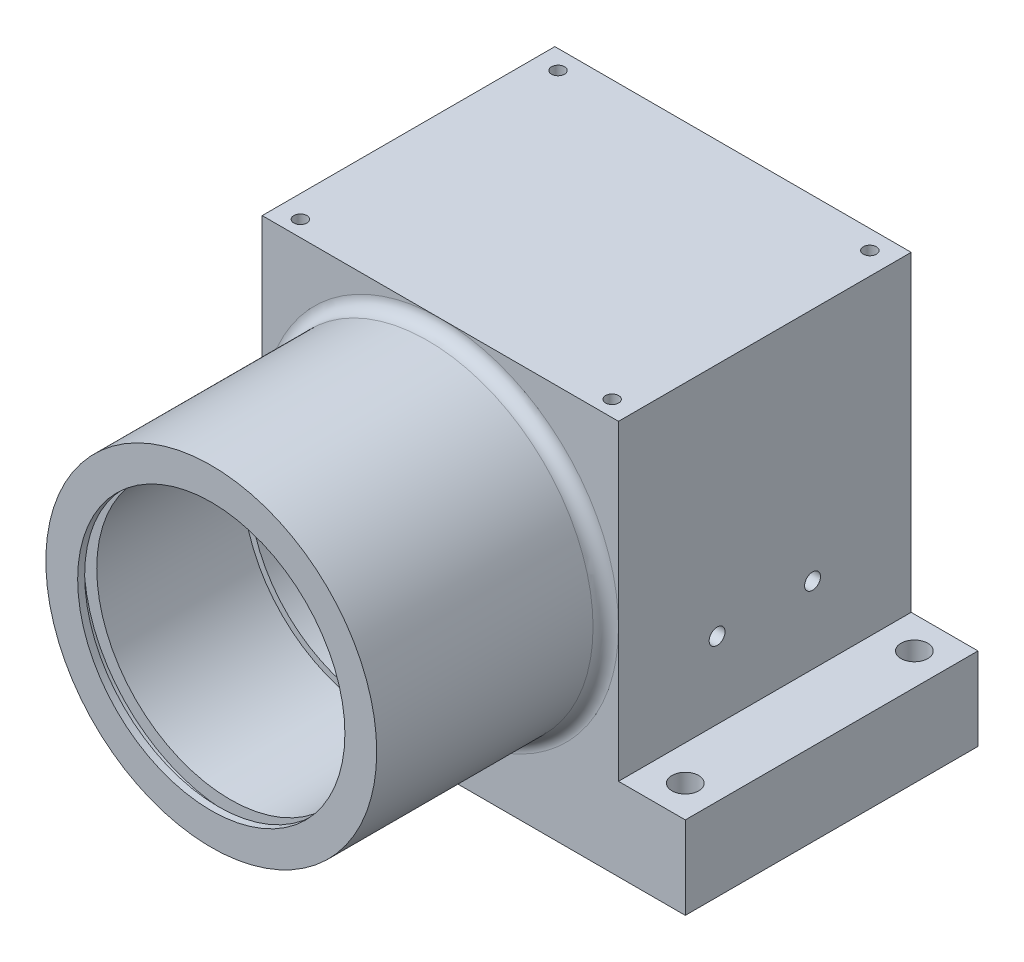
from build123d import *

# Parameters (mm, degrees)
SKETCH_1_W                  = 56
SKETCH_1_H                  = 62
EXTRUDE_1_DEPTH             = 82
SKETCH_4_W                  = 56
SKETCH_4_H                  = 62
SKETCH_4_R                  = 26
CUT_EXTRUDE_1_DEPTH         = 36
HOLE_WIZARD_M4_1_D          = 3.3
HOLE_WIZARD_M4_1_DEPTH      = 10.1
HOLE_WIZARD_M4_1_TIP        = 0.991420021
SKETCH_15_W                 = 23
SKETCH_15_H                 = 1.9
FILLET_1_R                  = 2
CHAMFER_2_SIZE              = 1
HOLE_WIZARD_M2_5_1_D        = 2.05
HOLE_WIZARD_M2_5_1_DEPTH    = 7.25
HOLE_WIZARD_M2_5_1_TIP      = 0.615882135
SKETCH_19_W                 = 10.5
SKETCH_19_H                 = 46
EXTRUDE_2_DEPTH             = 13
HOLE_WIZARD_M5_1_D          = 4.2
HOLE_WIZARD_M3_1_AT_2_COUNT = 2
HOLE_WIZARD_M3_1_AT_2_PITCH = 15


with BuildPart() as part:
    # 草图1 → 凸台-拉伸1 (new body)
    with BuildSketch(Plane.XY):
        with Locations((0, -3)):
            Rectangle(SKETCH_1_W, SKETCH_1_H)
    extrude(amount=EXTRUDE_1_DEPTH)

    # 草图3 → 切除-旋转2 (revolve, cut)
    with BuildSketch(Plane(origin=(0, 0, 0), x_dir=(0, 0, -1), z_dir=(1, 0, 0)), mode=Mode.PRIVATE) as cut_revolve_2_sk:
        Polygon((-82, 0), (0, 0), (0, 23), (-52, 23), (-52, 20), (-56, 20), (-56, 21), (-82, 21), align=None)
    revolve(cut_revolve_2_sk.sketch.rotate(Axis((0, 0, -5.719261836), (0, 0, 1)), 90), axis=Axis((0, 0, -5.719261836), (0, 0, 1)), mode=Mode.SUBTRACT)

    # 草图4 → 切除-拉伸1 (cut)
    with BuildSketch(Plane.XY.offset(82)):
        with Locations((0, -3)):
            Rectangle(SKETCH_4_W, SKETCH_4_H)
        Circle(SKETCH_4_R, mode=Mode.SUBTRACT)
    extrude(amount=-CUT_EXTRUDE_1_DEPTH, mode=Mode.SUBTRACT)

    # M4 螺纹孔1
    with Locations(Plane(origin=(0, 0, 0), x_dir=(-1, 0, 0), z_dir=(0, 0, -1))):
        with Locations((18.384776311, 18.384776311), (18.384776311, -18.384776311), (-18.384776311, -18.384776311), (-18.384776311, 18.384776311)):
            Hole(HOLE_WIZARD_M4_1_D / 2, depth=HOLE_WIZARD_M4_1_DEPTH)
            with Locations((0, 0, -(HOLE_WIZARD_M4_1_DEPTH + HOLE_WIZARD_M4_1_TIP / 2))):  # 118° drill point
                Cone(0, HOLE_WIZARD_M4_1_D / 2, HOLE_WIZARD_M4_1_TIP, mode=Mode.SUBTRACT)

    # 草图15 → 切除-旋转3 (revolve, cut)
    with BuildSketch(Plane(origin=(0, 0, 0), x_dir=(1, 0, 0), z_dir=(0, 1, 0))):
        with Locations((-11.5, -79.95)):
            Rectangle(SKETCH_15_W, SKETCH_15_H)
    revolve(axis=Axis((0, 0, 0), (0, 0, 1)), mode=Mode.SUBTRACT)

    # 圆角1
    fillet_1_edges = [part.edges().sort_by_distance(p)[0] for p in [
        (-26, 0, 46),
    ]]
    fillet(fillet_1_edges, radius=FILLET_1_R - 0.0001)  # a hair under: the kernel refuses the full size

    # 倒角2
    chamfer_2_edges = [part.edges().sort_by_distance(p)[0] for p in [
        (23, 0, 0),
    ]]
    chamfer(chamfer_2_edges, length=CHAMFER_2_SIZE)

    # M2.5 螺纹孔1
    with Locations(Plane(origin=(0, 28, 0), x_dir=(1, 0, 0), z_dir=(0, 1, 0))):
        with Locations((24.5, -3), (-24.5, -43.5), (-24.5, -3), (24.5, -43.5)):
            Hole(HOLE_WIZARD_M2_5_1_D / 2, depth=HOLE_WIZARD_M2_5_1_DEPTH)
            with Locations((0, 0, -(HOLE_WIZARD_M2_5_1_DEPTH + HOLE_WIZARD_M2_5_1_TIP / 2))):  # 118° drill point
                Cone(0, HOLE_WIZARD_M2_5_1_D / 2, HOLE_WIZARD_M2_5_1_TIP, mode=Mode.SUBTRACT)

    # 草图19 → 凸台-拉伸2 (add)
    with BuildSketch(Plane.XZ.offset(34)):
        with Locations((33.25, 23)):
            Rectangle(SKETCH_19_W, SKETCH_19_H)
        with Locations((-33.25, 23)):
            Rectangle(SKETCH_19_W, SKETCH_19_H)
    extrude(amount=-EXTRUDE_2_DEPTH)

    # M5 螺纹孔1 (through all)
    with Locations(Plane(origin=(0, -34, 0), x_dir=(-1, 0, 0), z_dir=(0, -1, 0))):
        with Locations((33.5, -5), (-33.5, -41), (-33.5, -5), (33.5, -41)):
            Hole(HOLE_WIZARD_M5_1_D / 2)

    # 草图24 → M3 螺纹孔1 (revolve, cut)
    with BuildSketch(Plane(origin=(28, -9, 30.5), x_dir=(0, 0, -1), z_dir=(0, 1, 0))):
        Polygon((0, 0), (0, 6.251075774), (1.25, 5.5), (1.25, 0), align=None)
    hole_wizard_m3_1 = revolve(axis=Axis((34.35, -9, 30.5), (-1, 0, 0)), mode=Mode.SUBTRACT)

    # M3 螺纹孔1 at 2: M3 螺纹孔1 ×2
    with Locations(*[(0, 0, -i * HOLE_WIZARD_M3_1_AT_2_PITCH) for i in range(1, HOLE_WIZARD_M3_1_AT_2_COUNT)]):
        add(hole_wizard_m3_1, mode=Mode.SUBTRACT)

    # 镜向1: M3 螺纹孔1 across plane
    add(hole_wizard_m3_1.mirror(Plane(origin=(0, 0, 0), x_dir=(0, 0, 1), z_dir=(1, 0, 0))), mode=Mode.SUBTRACT)

    # 镜向1 copy 1 sketch → 镜向1 copy 1 (revolve, cut)
    with BuildSketch(Plane(origin=(-28, -9, 15.5), x_dir=(0, 0, -1), z_dir=(0, 1, 0))):
        Polygon((0, 0), (0, -6.251075774), (1.25, -5.5), (1.25, 0), align=None)
    revolve(axis=Axis((-34.35, -9, 15.5), (-1, 0, 0)), mode=Mode.SUBTRACT)


solid = part.part
